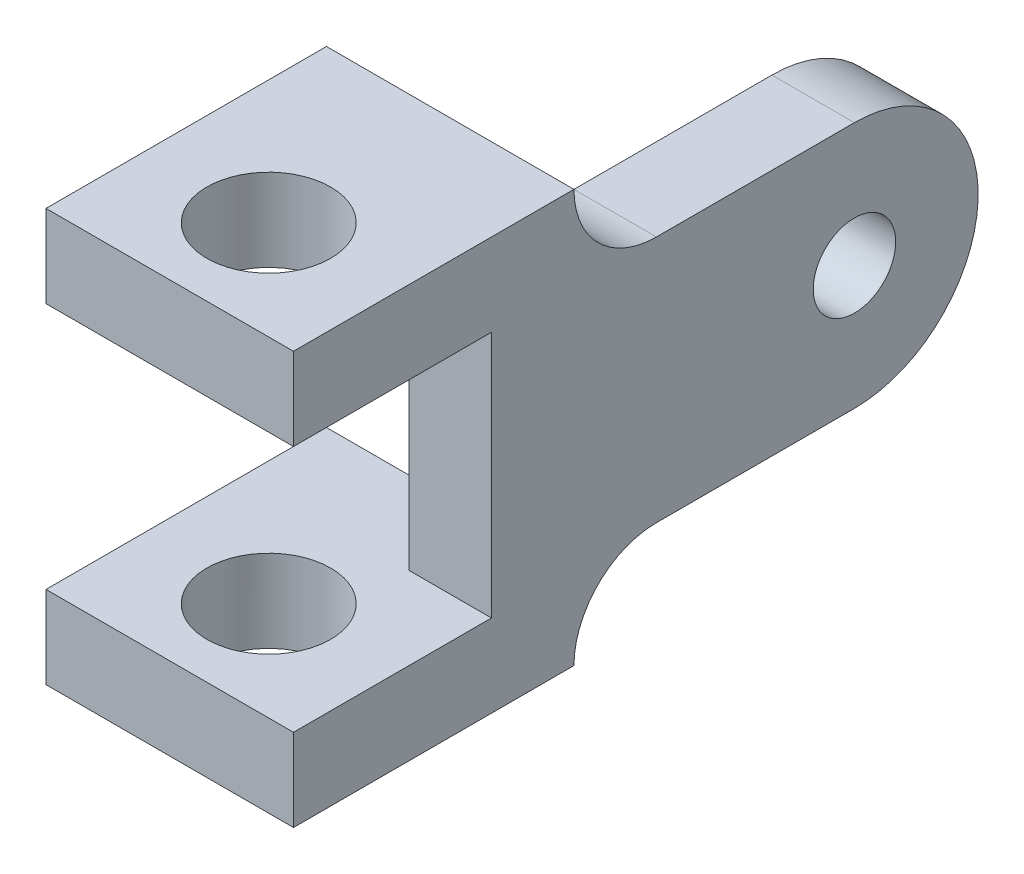
from build123d import *

# Parameters (mm, degrees)
BOSS_EXTRUDE1_DEPTH     = 50
FILLET1_R               = 50
SKETCH2_W               = 150
SKETCH2_H               = 170
BOSS_EXTRUDE2_DEPTH     = 50
SKETCH3_W               = 150
SKETCH3_H               = 170
BOSS_EXTRUDE3_DEPTH     = 50
CUT_EXTRUDE1_DEPTH      = 448.883913531
CUT_EXTRUDE1_DEPTH_BACK = 448.883913531
SKETCH4_R               = 37.5


with BuildPart() as part:
    # Sketch1 → Boss-Extrude1 (new body)
    # profile 1 of 4: a face of its own
    with BuildSketch(Plane.YZ):
        with BuildLine():
            Line((-75, 170), (-75, 0))
            ThreePointArc((-75, 0), (-53.033008589, 53.033008589), (0, 75))
            Line((0, 75), (0, 220))
            Line((0, 220), (-75, 220))
            Line((-75, 220), (-75, 340))
            Line((-75, 340), (-125, 340))
            Line((-125, 340), (-125, 170))
            Line((-125, 170), (-75, 170))
        make_face()
    # profile 2 of 4: a face of its own
    with BuildSketch(Plane.YZ):
        with BuildLine():
            ThreePointArc((0, 75), (53.033008589, 53.033008589), (75, 0))
            Line((75, 0), (75, 170))
            Line((75, 170), (125, 170))
            Line((125, 170), (125, 340))
            Line((125, 340), (75, 340))
            Line((75, 340), (75, 220))
            Line((75, 220), (0, 220))
            Line((0, 220), (0, 75))
        make_face()
    # profile 3 of 4: a face of its own
    with BuildSketch(Plane.YZ):
        with BuildLine():
            ThreePointArc((0, 75), (-53.033008589, 53.033008589), (-75, 0))
            ThreePointArc((-75, 0), (0, -75), (75, 0))
            ThreePointArc((75, 0), (53.033008589, 53.033008589), (0, 75))
        make_face()
        with BuildLine():
            ThreePointArc((25, 0), (-17.67766953, -17.67766953), (0, 25))
            ThreePointArc((0, 25), (17.67766953, 17.67766953), (25, 0))
        make_face(mode=Mode.SUBTRACT)
    # profile 4 of 4: a face of its own
    with BuildSketch(Plane.YZ):
        with BuildLine():
            ThreePointArc((0, 75), (-53.033008589, 53.033008589), (-75, 0))
            ThreePointArc((-75, 0), (0, -75), (75, 0))
            ThreePointArc((75, 0), (53.033008589, 53.033008589), (0, 75))
        make_face()
        with BuildLine():
            ThreePointArc((25, 0), (-17.67766953, -17.67766953), (0, 25))
            ThreePointArc((0, 25), (17.67766953, 17.67766953), (25, 0))
        make_face(mode=Mode.SUBTRACT)
    extrude(amount=-BOSS_EXTRUDE1_DEPTH)

    # Fillet1
    fillet1_edges = [part.edges().sort_by_distance(p)[0] for p in [
        (-25, 75, 170),
        (-25, -75, 170),
    ]]
    fillet(fillet1_edges, radius=FILLET1_R - 0.0001)  # a hair under: the kernel refuses the full size

    # Sketch2 → Boss-Extrude2 (add)
    with BuildSketch(Plane(origin=(0, 125, 0), x_dir=(-1, 0, 0), z_dir=(0, 1, 0))):
        with Locations((75, 255)):
            Rectangle(SKETCH2_W, SKETCH2_H)
    extrude(amount=-BOSS_EXTRUDE2_DEPTH)

    # Sketch3 → Boss-Extrude3 (add)
    with BuildSketch(Plane.XZ.offset(125)):
        with Locations((-75, 255)):
            Rectangle(SKETCH3_W, SKETCH3_H)
    extrude(amount=-BOSS_EXTRUDE3_DEPTH)

    # Sketch4 → Cut-Extrude1 (cut, two sides: drawn at the far end of the back side and taken through both)
    with BuildSketch(Plane.XZ.offset(125).offset(-CUT_EXTRUDE1_DEPTH_BACK)):
        with Locations(Location((-75, 280, 0), (0, 0, 270))):
            Circle(SKETCH4_R)
    extrude(amount=CUT_EXTRUDE1_DEPTH + CUT_EXTRUDE1_DEPTH_BACK, mode=Mode.SUBTRACT)


solid = part.part
